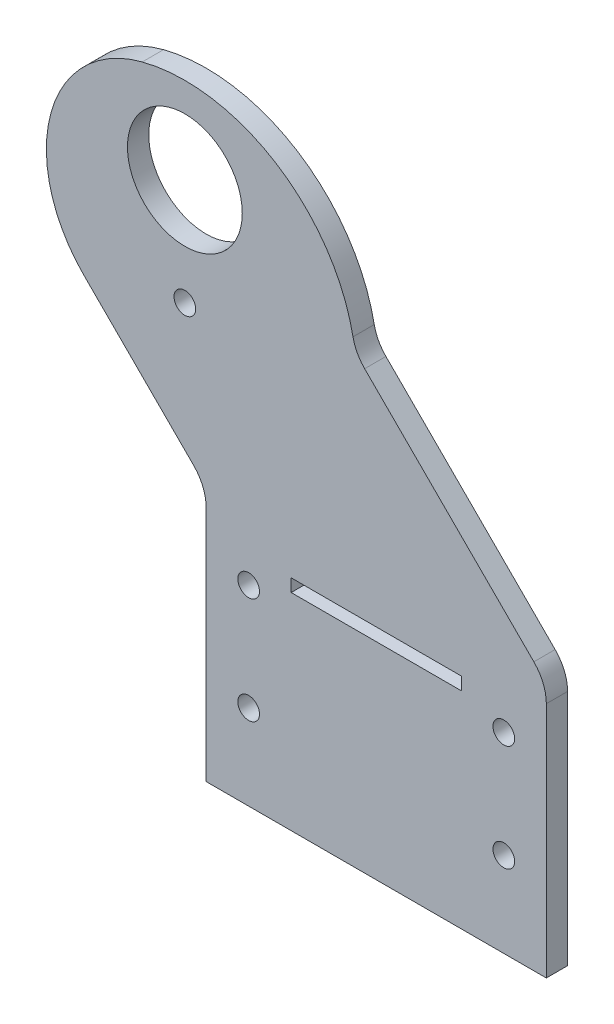
from build123d import *

# Parameters (mm, degrees)
SKETCH_1_R          = 2.55
SKETCH_1_R_2        = 13.5
EXTRUDE_1_DEPTH     = 5
FILLET_1_R          = 10
SKETCH_2_R          = 2.55
CUT_EXTRUDE_1_DEPTH = 112.121375081
FILLET_2_R          = 30
SKETCH_3_W          = 40
SKETCH_3_H          = 3
CUT_EXTRUDE_2_DEPTH = 112.121375081


with BuildPart() as part:
    # ｽｹｯﾁ1 → ﾎﾞｽ - 押し出し1 (new body)
    with BuildSketch(Plane.XY):
        with BuildLine():
            Line((40, 33.6), (85, -11.4))
            Line((85, -11.4), (85, -71.4))
            Line((85, -71.4), (5, -71.4))
            Line((5, -71.4), (5, -11.4))
            Line((5, -11.4), (-40, 33.6))
            ThreePointArc((-40, 33.6), (0, 68.911288741), (40, 33.6))
        make_face()
        with Locations((75, -26.4)):
            Circle(SKETCH_1_R, mode=Mode.SUBTRACT)
        with Locations((75, -51.4)):
            Circle(SKETCH_1_R, mode=Mode.SUBTRACT)
        with Locations((0, 23.6)):
            Circle(SKETCH_1_R, mode=Mode.SUBTRACT)
        with Locations((0, 48.6)):
            Circle(SKETCH_1_R_2, mode=Mode.SUBTRACT)
    extrude(amount=EXTRUDE_1_DEPTH)

    # ﾌｨﾚｯﾄ1
    fillet_1_edges = [part.edges().sort_by_distance(p)[0] for p in [
        (85, -11.4, 2.5),
        (40, 33.6, 2.5),
        (5, -11.4, 2.5),
    ]]
    fillet(fillet_1_edges, radius=FILLET_1_R)

    # ｽｹｯﾁ2 → ｶｯﾄ - 押し出し1 (cut, through all)
    with BuildSketch(Plane.XY.offset(5)):
        with Locations((15, -51.4)):
            Circle(SKETCH_2_R)
        with Locations((15, -26.4)):
            Circle(SKETCH_2_R)
    extrude(amount=-CUT_EXTRUDE_1_DEPTH, mode=Mode.SUBTRACT)

    # ﾌｨﾚｯﾄ2
    fillet_2_edges = [part.edges().sort_by_distance(p)[0] for p in [
        (-40, 33.6, 2.5),
    ]]
    fillet(fillet_2_edges, radius=FILLET_2_R)

    # ｽｹｯﾁ3 → ｶｯﾄ - 押し出し2 (cut, through all)
    with BuildSketch(Plane(origin=(0, 0, 0), x_dir=(-1, 0, 0), z_dir=(0, 0, -1))):
        with Locations((-45, -21.4)):
            Rectangle(SKETCH_3_W, SKETCH_3_H)
    extrude(amount=-CUT_EXTRUDE_2_DEPTH, mode=Mode.SUBTRACT)


solid = part.part
